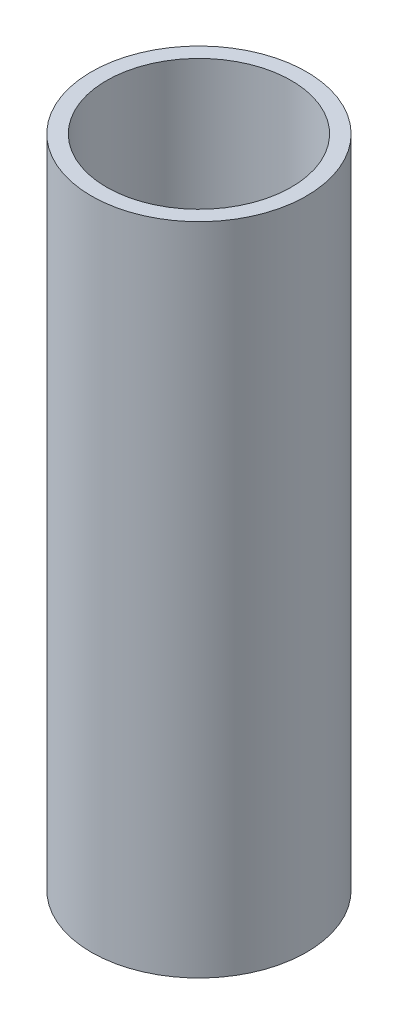
from build123d import *

# Parameters (mm, degrees)
SKETCH1_R           = 36.5125
SKETCH1_R_2         = 31.3563
BOSS_EXTRUDE1_DEPTH = 222.25


with BuildPart() as part:
    # Sketch1 → Boss-Extrude1 (new body)
    with BuildSketch(Plane(origin=(0, 0, 0), x_dir=(1, 0, 0), z_dir=(0, 1, 0))):
        Circle(SKETCH1_R)
        Circle(SKETCH1_R_2, mode=Mode.SUBTRACT)
    extrude(amount=-BOSS_EXTRUDE1_DEPTH)


solid = part.part
